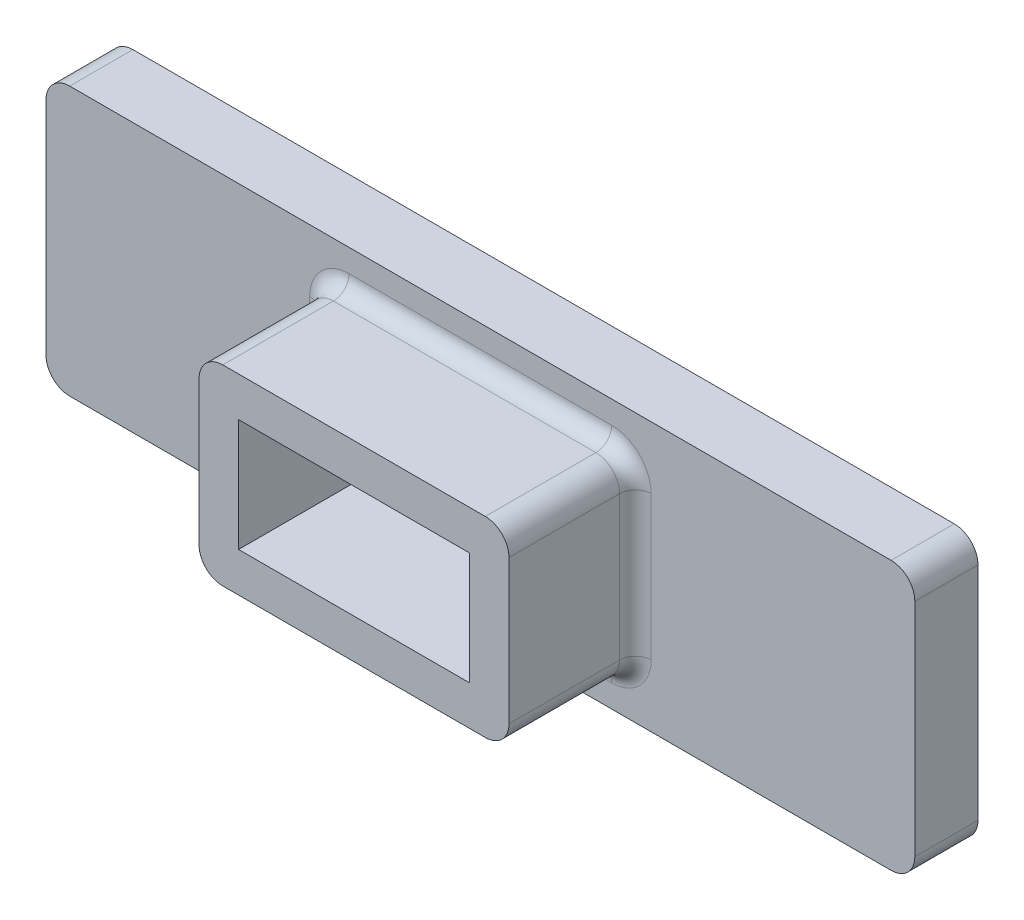
from build123d import *

# Parameters (mm, degrees)
SKETCH1_W           = 69.85
SKETCH1_H           = 21.59
BOSS_EXTRUDE1_DEPTH = 5.08
SKETCH2_W           = 24.9174
SKETCH2_H           = 15.3924
SKETCH2_W_2         = 18.5674
SKETCH2_H_2         = 9.0424
BOSS_EXTRUDE2_DEPTH = 10.16
FILLET2_R           = 1.905
FILLET3_R           = 1.27


with BuildPart() as part:
    # Sketch1 → Boss-Extrude1 (new body)
    with BuildSketch(Plane.XY):
        Rectangle(SKETCH1_W, SKETCH1_H)
    extrude(amount=BOSS_EXTRUDE1_DEPTH)

    # Sketch2 → Boss-Extrude2 (add)
    with BuildSketch(Plane.XY.offset(5.08)):
        Rectangle(SKETCH2_W, SKETCH2_H)
        Rectangle(SKETCH2_W_2, SKETCH2_H_2, mode=Mode.SUBTRACT)
    extrude(amount=BOSS_EXTRUDE2_DEPTH)

    # Fillet2
    fillet2_edges = [part.edges().sort_by_distance(p)[0] for p in [
        (-12.4587, 7.6962, 10.16),
        (12.4587, 7.6962, 10.16),
        (12.4587, -7.6962, 10.16),
        (-12.4587, -7.6962, 10.16),
        (34.925, 10.795, 2.54),
        (34.925, -10.795, 2.54),
        (-34.925, 10.795, 2.54),
        (-34.925, -10.795, 2.54),
    ]]
    fillet(fillet2_edges, radius=FILLET2_R)

    # Fillet3
    fillet3_edges = [part.edges().sort_by_distance(p)[0] for p in [
        (-11.900738418, -7.138238418, 5.08),
        (-12.4587, 0, 5.08),
        (-11.900738418, 7.138238418, 5.08),
        (0, 7.6962, 5.08),
        (11.900738418, 7.138238418, 5.08),
        (12.4587, 0, 5.08),
        (11.900738418, -7.138238418, 5.08),
        (0, -7.6962, 5.08),
    ]]
    fillet(fillet3_edges, radius=FILLET3_R)


solid = part.part
